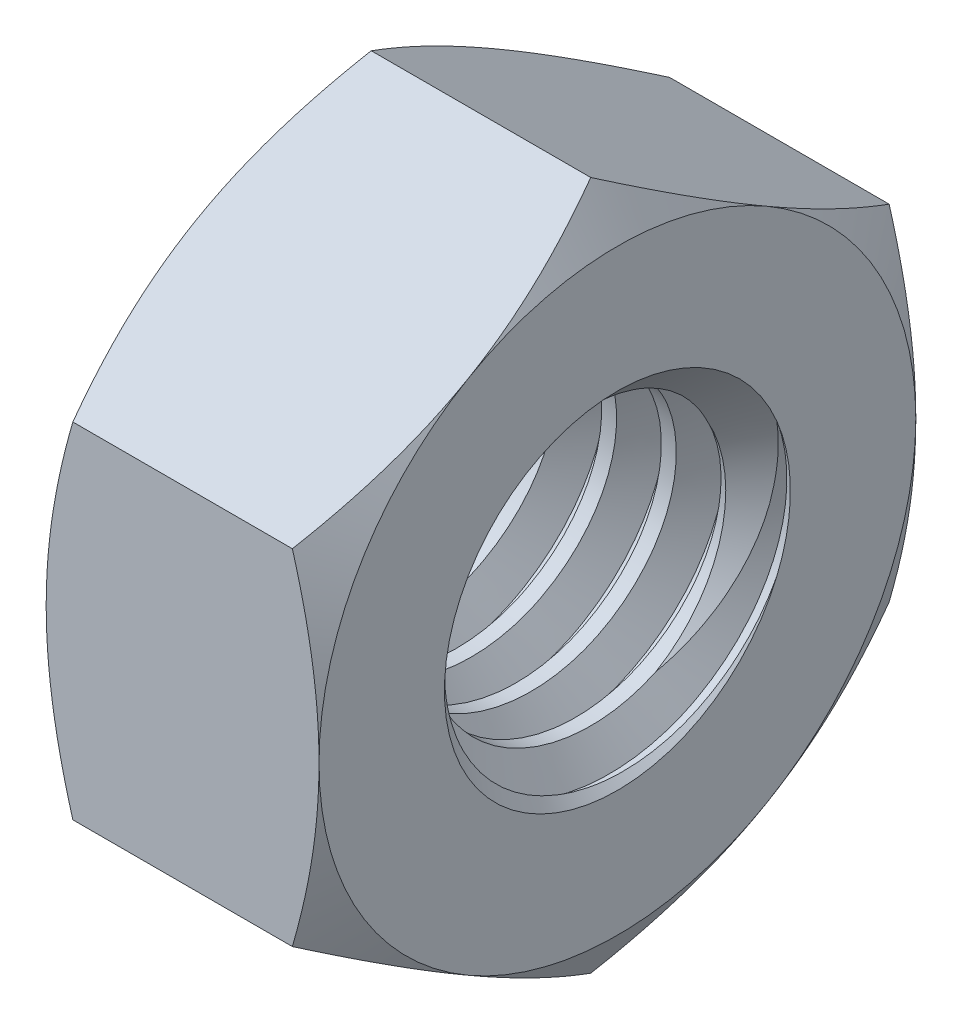
from build123d import *

# Parameters (mm, degrees)
SKETCH1_R           = 1.65
BOSS_EXTRUDE1_DEPTH = 1.6
CHAMFER1_SIZE       = 0.379
CUT_SWEEP1_PITCH    = 0.7


with BuildPart() as part:
    # Sketch1 → Boss-Extrude1 (new, symmetric)
    with BuildSketch(Plane(origin=(0, 0, 0), x_dir=(0, 0, -1), z_dir=(1, 0, 0))):
        Polygon((3.5, 2.020725942), (3.5, -2.020725942), (0, -4.041451884), (-3.5, -2.020725942), (-3.5, 2.020725942), (0, 4.041451884), align=None)
        Circle(SKETCH1_R, mode=Mode.SUBTRACT)
    extrude(amount=BOSS_EXTRUDE1_DEPTH, both=True)

    # Sketch4 → Cut-Revolve1 (revolve, cut)
    with BuildSketch(Plane.XY):
        Polygon((-1.6, 3.5), (-1.6, 5.227530151), (-0.602610002, 5.227530151), align=None)
    cut_revolve1 = revolve(axis=Axis((-2.7190736, 0, 0), (1, 0, 0)), mode=Mode.SUBTRACT)

    # Mirror1: Cut-Revolve1 across plane
    add(cut_revolve1.mirror(Plane(origin=(0, 0, 0), x_dir=(0, 0, 1), z_dir=(1, 0, 0))), mode=Mode.SUBTRACT)

    # Chamfer1
    chamfer1_edges = [part.edges().sort_by_distance(p)[0] for p in [
        (-1.6, 0, 1.65),
        (1.6, 0, 1.65),
    ]]
    chamfer(chamfer1_edges, length=CHAMFER1_SIZE)

    # Cut-Sweep1: the profile of Sketch7 screwed along a right-hand helix of 7.142857 turns, 6 arcs to a turn; built about Z, then put on its axis
    cut_sweep1_z = Axis((0, 0, 0), (0, 0, 1))
    cut_sweep1_corners = [(0.950448392, 0, 0.666452061), (0.950448392, 0, -0.666452061), (2.029, 0, -0.04375), (2.029, 0, 0.04375)]
    with BuildLine(mode=Mode.PRIVATE) as cut_sweep1_profile:
        Line(cut_sweep1_corners[0], cut_sweep1_corners[1])
        Line(cut_sweep1_corners[1], cut_sweep1_corners[2])
        Line(cut_sweep1_corners[2], cut_sweep1_corners[3])
        Line(cut_sweep1_corners[3], cut_sweep1_corners[0])
    cut_sweep1_cap = Face(cut_sweep1_profile.wire())
    cut_sweep1_turn_angles = [0, 30, 60, 90, 120, 150, 180, 210, 240, 270, 300, 330, 360]
    cut_sweep1_turn_weights = [1, 0.8660254037844387, 1, 0.8660254037844387, 1, 0.8660254037844387, 1, 0.8660254037844387, 1, 0.8660254037844387, 1, 0.8660254037844387, 1]
    cut_sweep1_turn_rails = [Edge.make_bspline([Vector(p[0], p[1], 0).rotate(cut_sweep1_z, cut_sweep1_turn_angles[k]) / cut_sweep1_turn_weights[k] + Vector(0, 0, p[2] + CUT_SWEEP1_PITCH * cut_sweep1_turn_angles[k] / 360) for k in range(13)], [0, 0, 0, 1, 1, 2, 2, 3, 3, 4, 4, 5, 5, 6, 6, 6], 2, cut_sweep1_turn_weights) for p in cut_sweep1_corners]
    cut_sweep1_turn_sides = [Face.make_surface_from_curves(cut_sweep1_turn_rails[p[0]], cut_sweep1_turn_rails[p[1]]) for p in [(0, 1), (1, 2), (2, 3), (3, 0)]]
    cut_sweep1_last_angles = [2520, 2545.714285714, 2571.428571429]
    cut_sweep1_last_weights = [1, 0.9009688679024169, 1]
    cut_sweep1_last_rails = [Edge.make_bspline([Vector(p[0], p[1], 0).rotate(cut_sweep1_z, cut_sweep1_last_angles[k]) / cut_sweep1_last_weights[k] + Vector(0, 0, p[2] + CUT_SWEEP1_PITCH * cut_sweep1_last_angles[k] / 360) for k in range(3)], [0, 0, 0, 1, 1, 1], 2, cut_sweep1_last_weights) for p in cut_sweep1_corners]
    cut_sweep1_last_sides = [Face.make_surface_from_curves(cut_sweep1_last_rails[p[0]], cut_sweep1_last_rails[p[1]]) for p in [(0, 1), (1, 2), (2, 3), (3, 0)]]
    cut_sweep1 = Plane(origin=(2.3, 0, 0), x_dir=(0, 0, -1), z_dir=(-1, 0, 0)) * Solid(Shell([*[p.moved(Location((0, 0, CUT_SWEEP1_PITCH * i))) for i in range(7) for p in cut_sweep1_turn_sides], *cut_sweep1_last_sides, cut_sweep1_cap, cut_sweep1_cap.rotate(cut_sweep1_z, 2571.428571429).moved(Location((0, 0, CUT_SWEEP1_PITCH * 2571.428571429 / 360)))]))
    add(cut_sweep1, mode=Mode.SUBTRACT)


solid = part.part
